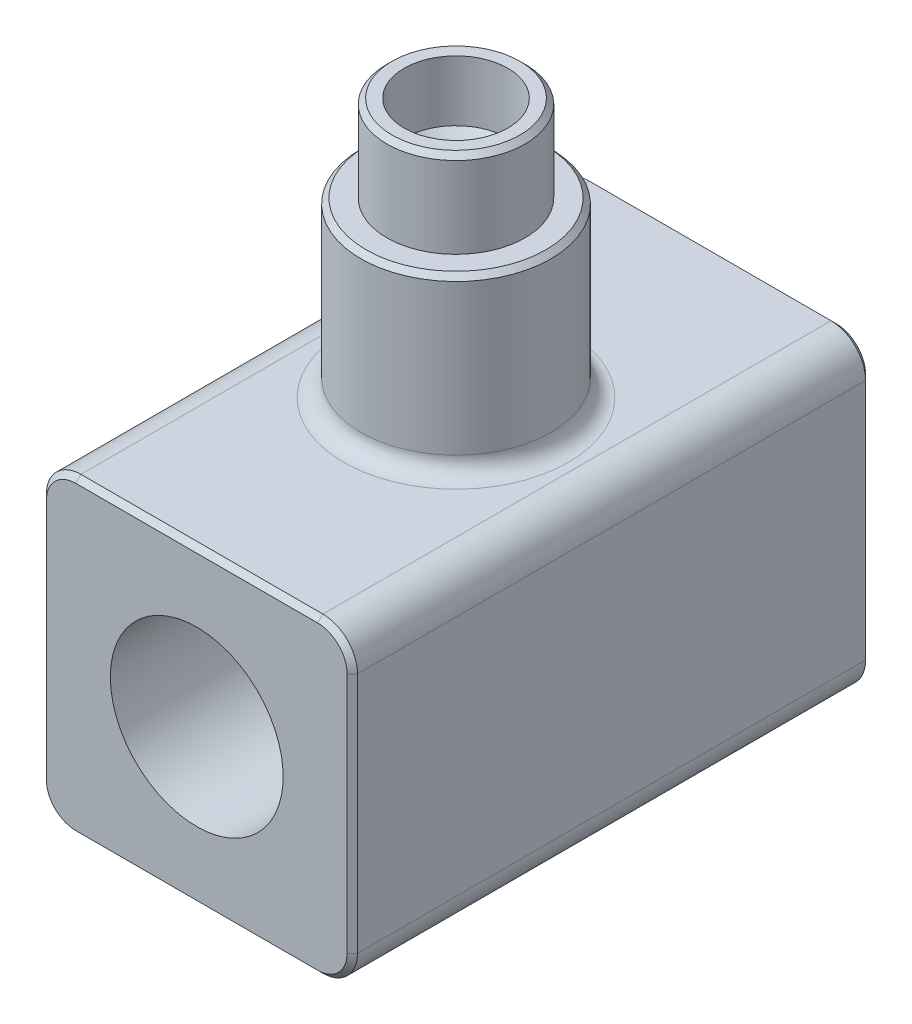
from build123d import *

# Parameters (mm, degrees)
SKETCH1_W           = 18
SKETCH1_H           = 18
BOSS_EXTRUDE1_DEPTH = 30
FILLET1_R           = 2
SKETCH2_R           = 5
CUT_EXTRUDE1_DEPTH  = 12
SKETCH3_R           = 5.5
BOSS_EXTRUDE2_DEPTH = 10
SKETCH4_R           = 4
BOSS_EXTRUDE3_DEPTH = 5
SKETCH5_R           = 3
CUT_EXTRUDE2_DEPTH  = 3
SKETCH6_R           = 1.5
CUT_EXTRUDE3_DEPTH  = 19
CHAMFER1_SIZE       = 2
FILLET2_R           = 1
SKETCH7_R           = 1.5
CUT_EXTRUDE4_DEPTH  = 32.320919527
CHAMFER2_SIZE       = 0.3


with BuildPart() as part:
    # Sketch1 → Boss-Extrude1 (new body)
    with BuildSketch(Plane.XY):
        Rectangle(SKETCH1_W, SKETCH1_H)
    extrude(amount=BOSS_EXTRUDE1_DEPTH)

    # Fillet1
    fillet1_edges = [part.edges().sort_by_distance(p)[0] for p in [
        (-9, 9, 15),
        (9, 9, 15),
        (9, -9, 15),
        (-9, -9, 15),
    ]]
    fillet(fillet1_edges, radius=FILLET1_R)

    # Sketch2 → Cut-Extrude1 (cut)
    with BuildSketch(Plane(origin=(0, 0, 0), x_dir=(-1, 0, 0), z_dir=(0, 0, -1))):
        Circle(SKETCH2_R)
    cut_extrude1 = extrude(amount=-CUT_EXTRUDE1_DEPTH, mode=Mode.SUBTRACT)

    # Mirror1: Cut-Extrude1 across plane
    add(cut_extrude1.mirror(Plane.XY.offset(15)), mode=Mode.SUBTRACT)

    # Sketch3 → Boss-Extrude2 (add)
    with BuildSketch(Plane(origin=(0, 9, 0), x_dir=(1, 0, 0), z_dir=(0, 1, 0))):
        with Locations((0, -15)):
            Circle(SKETCH3_R)
    extrude(amount=BOSS_EXTRUDE2_DEPTH)

    # Sketch4 → Boss-Extrude3 (add)
    with BuildSketch(Plane(origin=(0, 19, 0), x_dir=(1, 0, 0), z_dir=(0, 1, 0))):
        with Locations(Location((0, -15, 0), (0, 0, 180))):
            Circle(SKETCH4_R)
    extrude(amount=BOSS_EXTRUDE3_DEPTH)

    # Sketch5 → Cut-Extrude2 (cut)
    with BuildSketch(Plane(origin=(0, 24, 0), x_dir=(1, 0, 0), z_dir=(0, 1, 0))):
        with Locations(Location((0, -15, 0), (0, 0, 180))):
            Circle(SKETCH5_R)
    extrude(amount=-CUT_EXTRUDE2_DEPTH, mode=Mode.SUBTRACT)

    # Sketch6 → Cut-Extrude3 (cut)
    with BuildSketch(Plane(origin=(0, 21, 0), x_dir=(1, 0, 0), z_dir=(0, 1, 0))):
        with Locations(Location((0, -15, 0), (0, 0, 180))):
            Circle(SKETCH6_R)
    extrude(amount=-CUT_EXTRUDE3_DEPTH, mode=Mode.SUBTRACT)

    # Chamfer1
    # the kernel refuses this chamfer: 2 mm, written as the material it takes off along each edge
    with BuildSketch(Plane(origin=(0, 21, 15), x_dir=(-1, 0, 0), z_dir=(0, 0, -1))) as chamfer1_piece_1_section:
        Polygon((1.5 + CHAMFER1_SIZE, 0), (1.5, -CHAMFER1_SIZE), (1.5, 0), align=None)
    chamfer1_piece_1 = revolve(axis=Axis((0, 21, 15), (0, 1, 0)), mode=Mode.PRIVATE)
    chamfer1_piece_1 = chamfer1_piece_1 & Plane(origin=(0, 19.742805432, 15), x_dir=(-1, 0, 0), z_dir=(0, 1, 0)) * Cylinder(3, 14, mode=Mode.PRIVATE)
    add(chamfer1_piece_1, mode=Mode.SUBTRACT)

    # Fillet2
    fillet2_edges = [part.edges().sort_by_distance(p)[0] for p in [
        (-5.5, 9, 15),
    ]]
    fillet(fillet2_edges, radius=FILLET2_R)

    # Sketch7 → Cut-Extrude4 (cut, through all)
    with BuildSketch(Plane(origin=(0, 0, 12), x_dir=(-1, 0, 0), z_dir=(0, 0, -1))):
        Circle(SKETCH7_R)
    extrude(amount=-CUT_EXTRUDE4_DEPTH, mode=Mode.SUBTRACT)

    # Chamfer2
    chamfer2_edges = [part.edges().sort_by_distance(p)[0] for p in [
        (9, 0, 0),
        (9, 0, 30),
        (-9, 0, 0),
        (0, 9, 0),
        (0, -9, 0),
        (-8.414213562, 8.414213562, 0),
        (8.414213562, 8.414213562, 0),
        (-8.414213562, -8.414213562, 0),
        (8.414213562, -8.414213562, 0),
        (0, -9, 30),
        (-9, 0, 30),
        (0, 9, 30),
        (-8.414213562, 8.414213562, 30),
        (8.414213562, 8.414213562, 30),
        (-8.414213562, -8.414213562, 30),
        (8.414213562, -8.414213562, 30),
        (-5.5, 19, 15),
        (4, 24, 15),
    ]]
    chamfer(chamfer2_edges, length=CHAMFER2_SIZE)


solid = part.part
